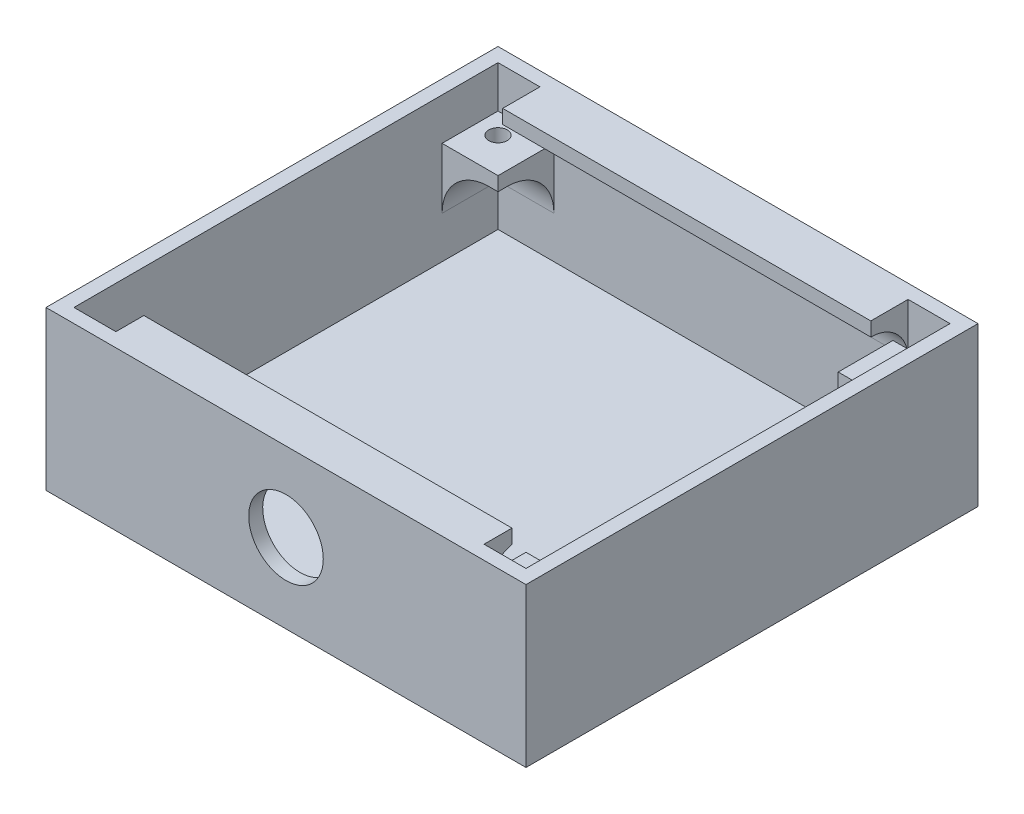
from build123d import *

# Parameters (mm, degrees)
SKETCH1_W          = 51.5
SKETCH1_H          = 48.5
BASE_DEPTH         = 1.5
SKETCH1_6_W        = 51.5
SKETCH1_6_H        = 48.5
WALLS_DEPTH        = 17
SCREWS_START       = 11
SKETCH1_7_R        = 1
SKETCH1_7_W        = 1.5
SKETCH1_7_H        = 3
SKETCH1_7_H_2      = 4
SCREWS_DEPTH       = 1.5
TOP_START          = 15.5
SKETCH1_8_W        = 39.5
SKETCH1_8_H        = 3
SKETCH1_8_H_2      = 4
TOP_DEPTH          = 1.5
FILLET1_R          = 5
FILLET3_R          = 4
SKETCH2_R          = 4
CUT_EXTRUDE1_DEPTH = 1.5


with BuildPart() as part:
    # Sketch1 → base (new body)
    with BuildSketch(Plane(origin=(0, 0, 0), x_dir=(1, 0, 0), z_dir=(0, 1, 0))):
        with Locations((24.25, 22.75)):
            Rectangle(SKETCH1_W, SKETCH1_H)
    extrude(amount=BASE_DEPTH)

    # Sketch1<6> → walls (add)
    with BuildSketch(Plane(origin=(0, 0, 0), x_dir=(1, 0, 0), z_dir=(0, 1, 0))):
        with Locations((24.25, 22.75)):
            Rectangle(SKETCH1_6_W, SKETCH1_6_H)
        Polygon((4.5, 0), (0, 0), (0, 4.5), (0, 6), (0, 39.5), (0, 41), (0, 45.5), (4.5, 45.5), (6, 45.5), (42.5, 45.5), (44, 45.5), (48.5, 45.5), (48.5, 41), (48.5, 39.5), (48.5, 6), (48.5, 4.5), (48.5, 0), (44, 0), (42.5, 0), (6, 0), align=None, mode=Mode.SUBTRACT)
    extrude(amount=WALLS_DEPTH)

    # Sketch1<7> → screws (add)
    # profile 1 of 12: a face of its own
    with BuildSketch(Plane(origin=(0, 0, 0), x_dir=(1, 0, 0), z_dir=(0, 1, 0)).offset(SCREWS_START)):
        Polygon((44, 3), (44, 0), (48.5, 0), (48.5, 4.5), (44, 4.5), align=None)
        with Locations(Location((46.25, 2.25, 0), (0, 0, 270))):
            Circle(SKETCH1_7_R, mode=Mode.SUBTRACT)
    # profile 2 of 12: a face of its own
    with BuildSketch(Plane(origin=(0, 0, 0), x_dir=(1, 0, 0), z_dir=(0, 1, 0)).offset(SCREWS_START)):
        Polygon((42.5, 6), (42.5, 3), (44, 3), (44, 4.5), (48.5, 4.5), (48.5, 6), align=None)
    # profile 3 of 12: a face of its own
    with BuildSketch(Plane(origin=(0, 0, 0), x_dir=(1, 0, 0), z_dir=(0, 1, 0)).offset(SCREWS_START)):
        with Locations((43.25, 1.5)):
            Rectangle(SKETCH1_7_W, SKETCH1_7_H)
    # profile 4 of 12: a face of its own
    with BuildSketch(Plane(origin=(0, 0, 0), x_dir=(1, 0, 0), z_dir=(0, 1, 0)).offset(SCREWS_START)):
        Polygon((44, 41.5), (42.5, 41.5), (42.5, 39.5), (48.5, 39.5), (48.5, 41), (44, 41), align=None)
    # profile 5 of 12: a face of its own
    with BuildSketch(Plane(origin=(0, 0, 0), x_dir=(1, 0, 0), z_dir=(0, 1, 0)).offset(SCREWS_START)):
        Polygon((44, 45.5), (44, 41.5), (44, 41), (48.5, 41), (48.5, 45.5), align=None)
        with Locations(Location((46.25, 43.25, 0), (0, 0, 270))):
            Circle(SKETCH1_7_R, mode=Mode.SUBTRACT)
    # profile 6 of 12: a face of its own
    with BuildSketch(Plane(origin=(0, 0, 0), x_dir=(1, 0, 0), z_dir=(0, 1, 0)).offset(SCREWS_START)):
        with Locations((43.25, 43.5)):
            Rectangle(SKETCH1_7_W, SKETCH1_7_H_2)
    # profile 7 of 12: a face of its own
    with BuildSketch(Plane(origin=(0, 0, 0), x_dir=(1, 0, 0), z_dir=(0, 1, 0)).offset(SCREWS_START)):
        Polygon((0, 41), (0, 39.5), (6, 39.5), (6, 41.5), (4.5, 41.5), (4.5, 41), align=None)
    # profile 8 of 12: a face of its own
    with BuildSketch(Plane(origin=(0, 0, 0), x_dir=(1, 0, 0), z_dir=(0, 1, 0)).offset(SCREWS_START)):
        Polygon((0, 45.5), (0, 41), (4.5, 41), (4.5, 41.5), (4.5, 45.5), align=None)
        with Locations(Location((2.25, 43.25, 0), (0, 0, 270))):
            Circle(SKETCH1_7_R, mode=Mode.SUBTRACT)
    # profile 9 of 12: a face of its own
    with BuildSketch(Plane(origin=(0, 0, 0), x_dir=(1, 0, 0), z_dir=(0, 1, 0)).offset(SCREWS_START)):
        with Locations((5.25, 43.5)):
            Rectangle(SKETCH1_7_W, SKETCH1_7_H_2)
    # profile 10 of 12: a face of its own
    with BuildSketch(Plane(origin=(0, 0, 0), x_dir=(1, 0, 0), z_dir=(0, 1, 0)).offset(SCREWS_START)):
        Polygon((0, 4.5), (0, 0), (4.5, 0), (4.5, 3), (4.5, 4.5), align=None)
        with Locations(Location((2.25, 2.25, 0), (0, 0, 270))):
            Circle(SKETCH1_7_R, mode=Mode.SUBTRACT)
    # profile 11 of 12: a face of its own
    with BuildSketch(Plane(origin=(0, 0, 0), x_dir=(1, 0, 0), z_dir=(0, 1, 0)).offset(SCREWS_START)):
        Polygon((0, 6), (0, 4.5), (4.5, 4.5), (4.5, 3), (6, 3), (6, 6), align=None)
    # profile 12 of 12: a face of its own
    with BuildSketch(Plane(origin=(0, 0, 0), x_dir=(1, 0, 0), z_dir=(0, 1, 0)).offset(SCREWS_START)):
        with Locations((5.25, 1.5)):
            Rectangle(SKETCH1_7_W, SKETCH1_7_H)
    extrude(amount=SCREWS_DEPTH)

    # Sketch1<8> → top (add)
    with BuildSketch(Plane(origin=(0, 0, 0), x_dir=(1, 0, 0), z_dir=(0, 1, 0)).offset(TOP_START)):
        with Locations((24.25, 1.5)):
            Rectangle(SKETCH1_8_W, SKETCH1_8_H)
        with Locations((24.25, 43.5)):
            Rectangle(SKETCH1_8_W, SKETCH1_8_H_2)
    extrude(amount=TOP_DEPTH)

    # Fillet1
    # the kernel refuses this fillet: 5 mm, written as the material it adds along each edge
    with BuildSketch(Plane(origin=(0, 11, 0), x_dir=(0, -1, 0), z_dir=(1, 0, 0))) as fillet1_piece_1_section:
        with BuildLine():
            CenterArc((FILLET1_R, FILLET1_R), FILLET1_R, 180, 90)
            Line((0, FILLET1_R), (0, 0))
            Line((0, 0), (FILLET1_R, 0))
        make_face()
    fillet1_piece_1 = extrude(amount=6, mode=Mode.PRIVATE)
    fillet1_piece_1 = fillet1_piece_1 - Plane(origin=(2.25, 9.80856061, -2.25), x_dir=(0, 0, 1), z_dir=(0, -1, 0)) * Cylinder(1, 33, mode=Mode.PRIVATE)
    add(fillet1_piece_1)
    with BuildSketch(Plane(origin=(0, 11, -6), x_dir=(0, -1, 0), z_dir=(0, 0, 1))) as fillet1_piece_2_section:
        with BuildLine():
            CenterArc((FILLET1_R, FILLET1_R), FILLET1_R, 180, 90)
            Line((0, FILLET1_R), (0, 0))
            Line((0, 0), (FILLET1_R, 0))
        make_face()
    fillet1_piece_2 = extrude(amount=6, mode=Mode.PRIVATE)
    fillet1_piece_2 = fillet1_piece_2 - Plane(origin=(2.25, 9.808553236, -2.25), x_dir=(0, 0, 1), z_dir=(0, -1, 0)) * Cylinder(1, 32, mode=Mode.PRIVATE)
    add(fillet1_piece_2)
    with BuildSketch(Plane(origin=(0, 11, -45.5), x_dir=(0, -1, 0), z_dir=(0, 0, 1))) as fillet1_piece_3_section:
        with BuildLine():
            CenterArc((FILLET1_R, FILLET1_R), FILLET1_R, 180, 90)
            Line((0, FILLET1_R), (0, 0))
            Line((0, 0), (FILLET1_R, 0))
        make_face()
    fillet1_piece_3 = extrude(amount=6, mode=Mode.PRIVATE)
    fillet1_piece_3 = fillet1_piece_3 - Plane(origin=(2.25, 9.808553112, -43.25), x_dir=(0, 0, 1), z_dir=(0, -1, 0)) * Cylinder(1, 32, mode=Mode.PRIVATE)
    add(fillet1_piece_3)
    with BuildSketch(Plane(origin=(0, 11, -45.5), x_dir=(0, -1, 0), z_dir=(1, 0, 0))) as fillet1_piece_4_section:
        with BuildLine():
            CenterArc((FILLET1_R, -FILLET1_R), FILLET1_R, 90, 90)
            Line((0, -FILLET1_R), (0, 0))
            Line((0, 0), (FILLET1_R, 0))
        make_face()
    fillet1_piece_4 = extrude(amount=6, mode=Mode.PRIVATE)
    fillet1_piece_4 = fillet1_piece_4 - Plane(origin=(2.25, 9.808558943, -43.25), x_dir=(0, 0, 1), z_dir=(0, -1, 0)) * Cylinder(1, 33, mode=Mode.PRIVATE)
    add(fillet1_piece_4)
    with BuildSketch(Plane(origin=(48.5, 11, -45.5), x_dir=(0, -1, 0), z_dir=(-1, 0, 0))) as fillet1_piece_5_section:
        with BuildLine():
            CenterArc((FILLET1_R, FILLET1_R), FILLET1_R, 180, 90)
            Line((0, FILLET1_R), (0, 0))
            Line((0, 0), (FILLET1_R, 0))
        make_face()
    fillet1_piece_5 = extrude(amount=6, mode=Mode.PRIVATE)
    fillet1_piece_5 = fillet1_piece_5 - Plane(origin=(46.25, 9.808558971, -43.25), x_dir=(0, 0, 1), z_dir=(0, -1, 0)) * Cylinder(1, 33, mode=Mode.PRIVATE)
    add(fillet1_piece_5)
    with BuildSketch(Plane(origin=(48.5, 11, -45.5), x_dir=(0, -1, 0), z_dir=(0, 0, 1))) as fillet1_piece_6_section:
        with BuildLine():
            CenterArc((FILLET1_R, -FILLET1_R), FILLET1_R, 90, 90)
            Line((0, -FILLET1_R), (0, 0))
            Line((0, 0), (FILLET1_R, 0))
        make_face()
    fillet1_piece_6 = extrude(amount=6, mode=Mode.PRIVATE)
    fillet1_piece_6 = fillet1_piece_6 - Plane(origin=(46.25, 9.808552814, -43.25), x_dir=(0, 0, 1), z_dir=(0, -1, 0)) * Cylinder(1, 33, mode=Mode.PRIVATE)
    add(fillet1_piece_6)
    with BuildSketch(Plane(origin=(48.5, 11, -6), x_dir=(0, -1, 0), z_dir=(0, 0, 1))) as fillet1_piece_7_section:
        with BuildLine():
            CenterArc((FILLET1_R, -FILLET1_R), FILLET1_R, 90, 90)
            Line((0, -FILLET1_R), (0, 0))
            Line((0, 0), (FILLET1_R, 0))
        make_face()
    fillet1_piece_7 = extrude(amount=6, mode=Mode.PRIVATE)
    fillet1_piece_7 = fillet1_piece_7 - Plane(origin=(46.25, 9.808552873, -2.25), x_dir=(0, 0, 1), z_dir=(0, -1, 0)) * Cylinder(1, 33, mode=Mode.PRIVATE)
    add(fillet1_piece_7)
    with BuildSketch(Plane(origin=(48.5, 11, 0), x_dir=(0, -1, 0), z_dir=(-1, 0, 0))) as fillet1_piece_8_section:
        with BuildLine():
            CenterArc((FILLET1_R, -FILLET1_R), FILLET1_R, 90, 90)
            Line((0, -FILLET1_R), (0, 0))
            Line((0, 0), (FILLET1_R, 0))
        make_face()
    fillet1_piece_8 = extrude(amount=6, mode=Mode.PRIVATE)
    fillet1_piece_8 = fillet1_piece_8 - Plane(origin=(46.25, 9.808560411, -2.25), x_dir=(0, 0, 1), z_dir=(0, -1, 0)) * Cylinder(1, 32, mode=Mode.PRIVATE)
    add(fillet1_piece_8)

    # Fillet3
    # the kernel refuses this fillet: 4 mm, written as the material it adds along each edge
    with BuildSketch(Plane(origin=(4.5, 15.5, 0), x_dir=(0, -1, 0), z_dir=(1, 0, 0))) as fillet3_piece_1:
        with BuildLine():
            CenterArc((3.872983346, 4), FILLET3_R, 194.477512186, 75.522487814)
            Line((0, 3), (0, 0))
            Line((0, 0), (3.872983346, 0))
        make_face()
    extrude(amount=39.5)
    with BuildSketch(Plane(origin=(44, 15.5, -45.5), x_dir=(0, -1, 0), z_dir=(-1, 0, 0))) as fillet3_piece_2:
        with BuildLine():
            CenterArc((FILLET3_R, FILLET3_R), FILLET3_R, 180, 90)
            Line((0, FILLET3_R), (0, 0))
            Line((0, 0), (FILLET3_R, 0))
        make_face()
    extrude(amount=39.5)

    # Sketch2 → Cut-Extrude1 (cut)
    with BuildSketch(Plane.XY.offset(1.5)):
        with Locations((24.25, 8.5)):
            Circle(SKETCH2_R)
    extrude(amount=-CUT_EXTRUDE1_DEPTH, mode=Mode.SUBTRACT)


solid = part.part
